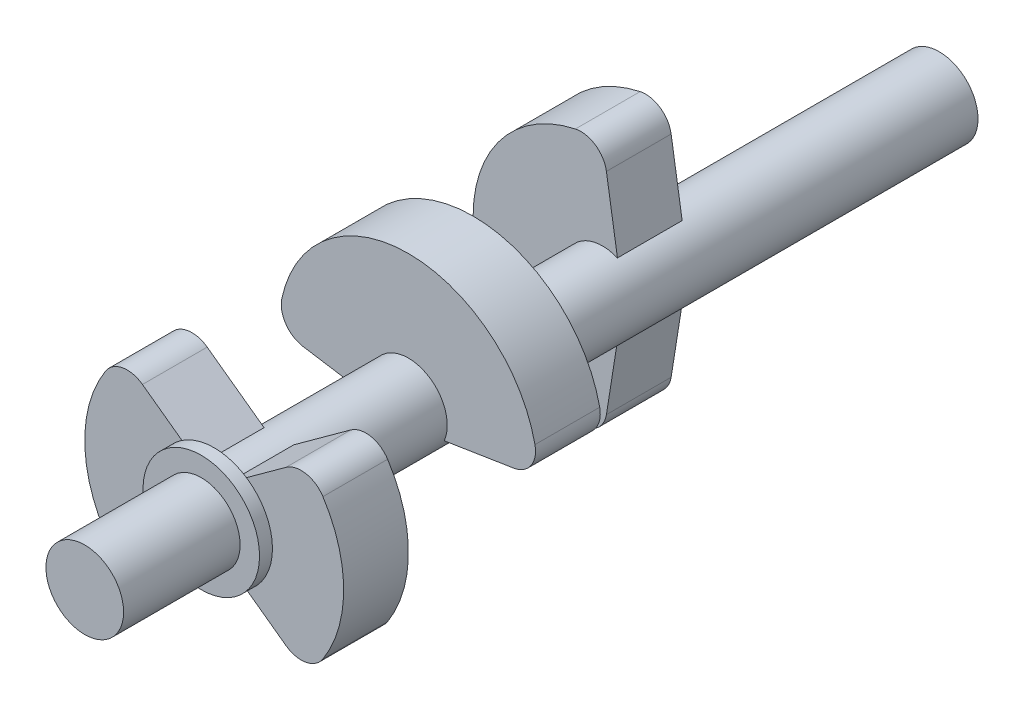
from build123d import *

# Parameters (mm, degrees)
SKETCH_2_R       = 1.5
SHAFT_DEPTH      = 33
EXCENTRIC1_DEPTH = 2.5
EXTRUDE_3_DEPTH  = 2.5
EXTRUDE_4_DEPTH  = 2.5
FILLET_1_R       = 1
SKETCH_7_R       = 2.25
EXTRUDE_5_DEPTH  = 0.5


with BuildPart() as part:
    # Эскиз2 → shaft (new body)
    with BuildSketch(Plane.XY):
        Circle(SKETCH_2_R)
    extrude(amount=SHAFT_DEPTH)

    # Эскиз3 → excentric1 (add)
    with BuildSketch(Plane(origin=(0, 0, 10.5), x_dir=(-1, 0, 0), z_dir=(0, 0, -1))):
        with BuildLine():
            ThreePointArc((5, 0), (3.535533906, 3.535533906), (0, 5))
            Line((0, 5), (-0.574025149, 1.385819299))
            ThreePointArc((-0.574025149, 1.385819299), (0.83335535, 1.247204418), (1.5, 0))
            ThreePointArc((1.5, 0), (0.83335535, -1.247204418), (-0.574025149, -1.385819299))
            Line((-0.574025149, -1.385819299), (0, -5))
            ThreePointArc((0, -5), (3.535533906, -3.535533906), (5, 0))
        make_face()
    extrude(amount=-EXCENTRIC1_DEPTH)

    # excentric2sketch → Бобышка-Вытянуть3 (add)
    with BuildSketch(Plane(origin=(0, 0, 18), x_dir=(-1, 0, 0), z_dir=(0, 0, -1))):
        with BuildLine():
            ThreePointArc((5, 0), (0, 5), (-5, 0))
            Line((-5, 0), (-1.385819299, -0.574025149))
            ThreePointArc((-1.385819299, -0.574025149), (-0.292635483, 1.471177921), (1.5, 0))
            ThreePointArc((1.5, 0), (1.471177921, -0.292635483), (1.385819299, -0.574025149))
            Line((1.385819299, -0.574025149), (5, 0))
        make_face()
    extrude(amount=-EXTRUDE_3_DEPTH)

    # excentric3sketch → Бобышка-Вытянуть4 (add)
    with BuildSketch(Plane(origin=(0, 0, 25.5), x_dir=(-1, 0, 0), z_dir=(0, 0, -1))):
        with BuildLine():
            ThreePointArc((3.535533906, -3.535533906), (5, 0), (3.535533906, 3.535533906))
            Line((3.535533906, 3.535533906), (0.574025149, 1.385819299))
            ThreePointArc((0.574025149, 1.385819299), (1.5, 0), (0.574025149, -1.385819299))
            Line((0.574025149, -1.385819299), (3.535533906, -3.535533906))
        make_face()
        with BuildLine():
            Line((-0.574025149, 1.385819299), (-3.535533906, 3.535533906))
            ThreePointArc((-3.535533906, 3.535533906), (-5, 0), (-3.535533906, -3.535533906))
            Line((-3.535533906, -3.535533906), (-0.574025149, -1.385819299))
            ThreePointArc((-0.574025149, -1.385819299), (-1.5, 0), (-0.574025149, 1.385819299))
        make_face()
    extrude(amount=-EXTRUDE_4_DEPTH)

    # Скругление1
    fillet_1_edges = [part.edges().sort_by_distance(p)[0] for p in [
        (-3.535533906, 3.535533906, 26.75),
        (3.535533906, 3.535533906, 26.75),
        (3.535533906, -3.535533906, 26.75),
        (-3.535533906, -3.535533906, 26.75),
        (-5, 0, 19.25),
        (5, 0, 19.25),
        (0, -5, 11.75),
        (0, 5, 11.75),
    ]]
    fillet(fillet_1_edges, radius=FILLET_1_R)

    # Эскиз7 → Бобышка-Вытянуть5 (add)
    with BuildSketch(Plane.XY.offset(28)):
        Circle(SKETCH_7_R)
    extrude(amount=EXTRUDE_5_DEPTH)


solid = part.part
